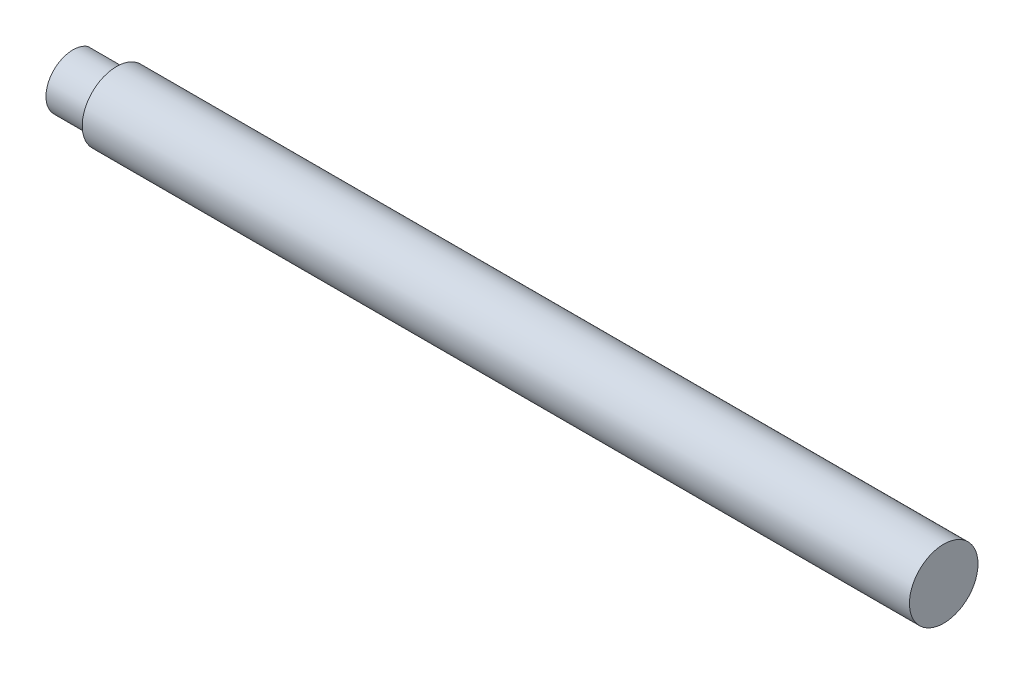
from build123d import *

# Parameters (mm, degrees)
SKETCH1_R          = 2.5
BASE_DEPTH         = 63.5
SKETCH2_OUTSIDE_W  = 19.778
SKETCH2_OUTSIDE_H  = 19.778
CUT_EXTRUDE1_DEPTH = 3.175


with BuildPart() as part:
    # Sketch1 → Base (new body)
    with BuildSketch(Plane(origin=(0, 0, 0), x_dir=(0, 0, -1), z_dir=(1, 0, 0))):
        Circle(SKETCH1_R)
    extrude(amount=BASE_DEPTH)

    # Sketch2 outside → Cut-Extrude1 (cut)
    with BuildSketch(Plane(origin=(0, 0, 0), x_dir=(0, 0, -1), z_dir=(1, 0, 0))):
        Rectangle(SKETCH2_OUTSIDE_W, SKETCH2_OUTSIDE_H)
        with BuildLine():
            Line((1.0795, 1.646108137), (1.0795, -1.646108137))
            ThreePointArc((1.0795, -1.646108137), (-1.9685, 0), (1.0795, 1.646108137))
        make_face(mode=Mode.SUBTRACT)
    extrude(amount=CUT_EXTRUDE1_DEPTH, mode=Mode.SUBTRACT)


solid = part.part
